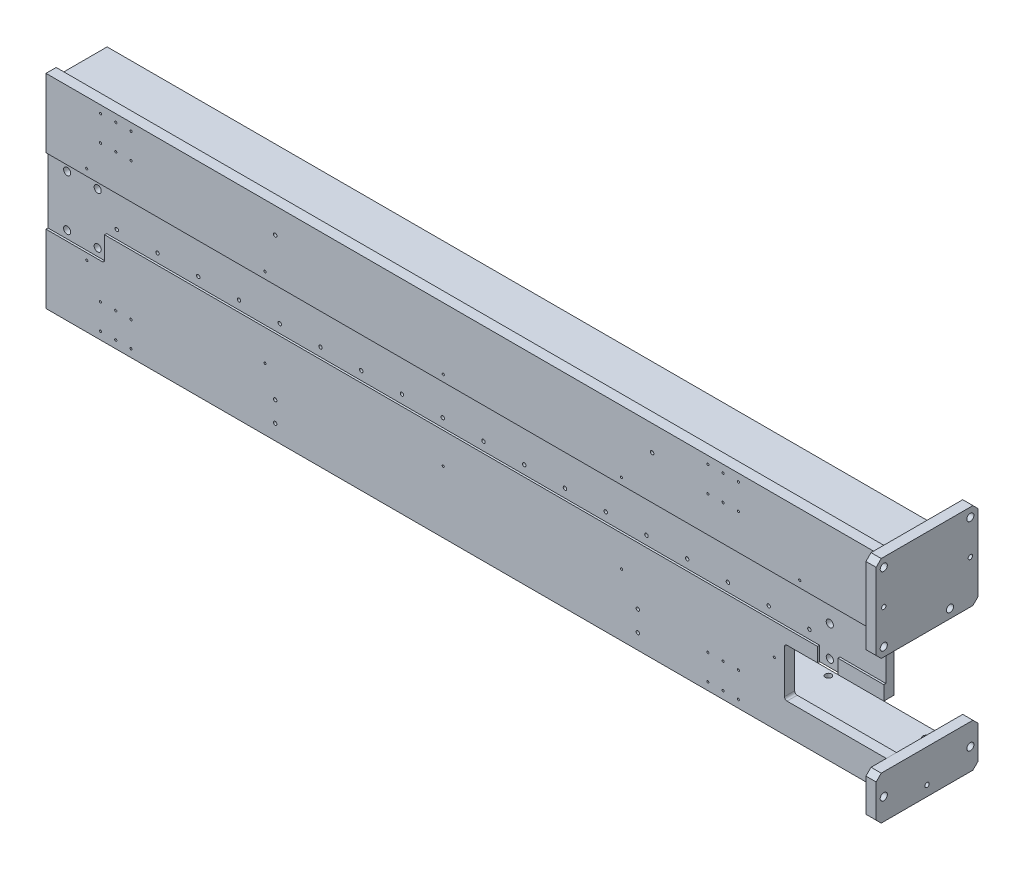
from build123d import *

# Parameters (mm, degrees)
SKETCH_1_W                   = 1650
SKETCH_1_H                   = 400
EXTRUDE_1_DEPTH              = 20
SKETCH_2_W                   = 1650
SKETCH_2_H                   = 20
EXTRUDE_2_DEPTH              = 100
EXTRUDE_2_2_DEPTH            = 100
SKETCH_3_W                   = 200
SKETCH_3_H                   = 450
EXTRUDE_3_DEPTH              = 20
SKETCH_4_W                   = 100
SKETCH_4_H                   = 330
EXTRUDE_4_DEPTH              = 20
CUT_EXTRUDE_5_DEPTH          = 4
SKETCH_17_W                  = 200
SKETCH_17_H                  = 95
CUT_EXTRUDE_6_DEPTH          = 889.960066595
SKETCH_18_W                  = 25
SKETCH_18_H                  = 195
CUT_EXTRUDE_7_DEPTH          = 898.022853667
FILLET_1_R                   = 5
CHAMFER_1_SIZE               = 10
CHAMFER_2_SIZE               = 10
HOLE_WIZARD_M5_1_AT_2_COUNT  = 2
HOLE_WIZARD_M5_1_AT_2_PITCH  = 156
HOLE_WIZARD_M5_1_AT_3_COUNT  = 2
HOLE_WIZARD_M5_1_AT_3_PITCH  = 350
HOLE_WIZARD_M5_1_AT_4_COUNT  = 2
HOLE_WIZARD_M5_1_AT_4_PITCH  = 383.191857951
HOLE_WIZARD_M5_1_AT_5_COUNT  = 2
HOLE_WIZARD_M5_1_AT_5_PITCH  = 700
HOLE_WIZARD_M5_1_AT_6_COUNT  = 2
HOLE_WIZARD_M5_1_AT_6_PITCH  = 717.172224783
HOLE_WIZARD_M5_1_AT_7_COUNT  = 2
HOLE_WIZARD_M5_1_AT_7_PITCH  = 1050
HOLE_WIZARD_M5_1_AT_8_COUNT  = 2
HOLE_WIZARD_M5_1_AT_8_PITCH  = 1061.525317644
HOLE_WIZARD_M5_1_AT_9_COUNT  = 2
HOLE_WIZARD_M5_1_AT_9_PITCH  = 1400
HOLE_WIZARD_M5_1_AT_10_COUNT = 2
HOLE_WIZARD_M5_1_AT_10_PITCH = 1358.983443608
SKETCH_22_W                  = 3.4
SKETCH_22_H                  = 60
HOLE_WIZARD_M8_1_AT_2_COUNT  = 2
HOLE_WIZARD_M8_1_AT_2_PITCH  = 80
HOLE_WIZARD_M8_1_AT_3_COUNT  = 2
HOLE_WIZARD_M8_1_AT_3_PITCH  = 160
HOLE_WIZARD_M8_1_AT_4_COUNT  = 2
HOLE_WIZARD_M8_1_AT_4_PITCH  = 240
HOLE_WIZARD_M8_1_AT_5_COUNT  = 2
HOLE_WIZARD_M8_1_AT_5_PITCH  = 320
HOLE_WIZARD_M8_1_AT_6_COUNT  = 2
HOLE_WIZARD_M8_1_AT_6_PITCH  = 400
HOLE_WIZARD_M8_1_AT_7_COUNT  = 2
HOLE_WIZARD_M8_1_AT_7_PITCH  = 560
HOLE_WIZARD_M8_1_AT_8_COUNT  = 2
HOLE_WIZARD_M8_1_AT_8_PITCH  = 640
HOLE_WIZARD_M8_1_AT_9_COUNT  = 2
HOLE_WIZARD_M8_1_AT_9_PITCH  = 720
HOLE_WIZARD_M8_1_AT_10_COUNT = 2
HOLE_WIZARD_M8_1_AT_10_PITCH = 800
HOLE_WIZARD_M8_1_AT_11_COUNT = 2
HOLE_WIZARD_M8_1_AT_11_PITCH = 880
HOLE_WIZARD_M8_1_AT_12_COUNT = 2
HOLE_WIZARD_M8_1_AT_12_PITCH = 960
HOLE_WIZARD_M8_1_AT_13_COUNT = 2
HOLE_WIZARD_M8_1_AT_13_PITCH = 1040
HOLE_WIZARD_M8_1_AT_14_COUNT = 2
HOLE_WIZARD_M8_1_AT_14_PITCH = 1120
HOLE_WIZARD_M8_1_AT_15_COUNT = 2
HOLE_WIZARD_M8_1_AT_15_PITCH = 480
HOLE_WIZARD_M8_1_AT_16_COUNT = 2
HOLE_WIZARD_M8_1_AT_16_PITCH = 1200
HOLE_WIZARD_M8_1_AT_17_COUNT = 2
HOLE_WIZARD_M8_1_AT_17_PITCH = 1280
HOLE_WIZARD_M8_1_AT_18_COUNT = 2
HOLE_WIZARD_M8_1_AT_18_PITCH = 1360
SKETCH_23_R                  = 7
CUT_EXTRUDE_8_DEPTH          = 886.578906705
SKETCH_24_R                  = 7
CUT_EXTRUDE_9_DEPTH          = 1672.144817184
SKETCH_26_R                  = 6
CUT_EXTRUDE_11_DEPTH         = 25
SKETCH_29_W                  = 10
SKETCH_29_H                  = 330
EXTRUDE_5_DEPTH              = 50
EXTRUDE_5_2_DEPTH            = 50
EXTRUDE_5_3_DEPTH            = 50
HOLE_WIZARD_M5_2_AT_2_COUNT  = 2
HOLE_WIZARD_M5_2_AT_2_PITCH  = 1234.688725955
HOLE_WIZARD_M5_2_AT_3_COUNT  = 2
HOLE_WIZARD_M5_2_AT_3_PITCH  = 276.586333719
HOLE_WIZARD_M5_2_AT_4_COUNT  = 2
HOLE_WIZARD_M5_2_AT_4_PITCH  = 271.661554144
HOLE_WIZARD_M5_2_AT_5_COUNT  = 2
HOLE_WIZARD_M5_2_AT_5_PITCH  = 321.4031736
HOLE_WIZARD_M5_2_AT_6_COUNT  = 2
HOLE_WIZARD_M5_2_AT_6_PITCH  = 325.576411922
HOLE_WIZARD_M5_2_AT_7_COUNT  = 2
HOLE_WIZARD_M5_2_AT_7_PITCH  = 1193.443023357
HOLE_WIZARD_M5_2_AT_8_COUNT  = 2
HOLE_WIZARD_M5_2_AT_8_PITCH  = 1222.684035227
HOLE_WIZARD_M5_2_AT_9_COUNT  = 2
HOLE_WIZARD_M5_2_AT_9_PITCH  = 1205.73888135
HOLE_WIZARD_M5_2_AT_10_COUNT = 2
HOLE_WIZARD_M5_2_AT_10_PITCH = 270
HOLE_WIZARD_M5_2_AT_11_COUNT = 2
HOLE_WIZARD_M5_2_AT_11_PITCH = 320
HOLE_WIZARD_M5_2_AT_12_COUNT = 2
HOLE_WIZARD_M5_2_AT_12_PITCH = 1164.240632344
HOLE_WIZARD_M5_2_AT_13_COUNT = 2
HOLE_WIZARD_M5_2_AT_13_PITCH = 1176.841641853
HOLE_WIZARD_M5_2_AT_14_COUNT = 2
HOLE_WIZARD_M5_2_AT_14_PITCH = 1133.603215415
HOLE_WIZARD_M5_2_AT_15_COUNT = 2
HOLE_WIZARD_M5_2_AT_15_PITCH = 1163.574771985
HOLE_WIZARD_M5_2_AT_16_COUNT = 2
HOLE_WIZARD_M5_2_AT_16_PITCH = 1193.547757737
HOLE_WIZARD_M5_2_AT_17_COUNT = 2
HOLE_WIZARD_M5_2_AT_17_PITCH = 1132.5
HOLE_WIZARD_M5_2_AT_18_COUNT = 2
HOLE_WIZARD_M5_2_AT_18_PITCH = 1162.5
HOLE_WIZARD_M5_2_AT_19_COUNT = 2
HOLE_WIZARD_M5_2_AT_19_PITCH = 1192.5
HOLE_WIZARD_M5_2_AT_20_COUNT = 2
HOLE_WIZARD_M5_2_AT_20_PITCH = 78.102496759
HOLE_WIZARD_M5_2_AT_21_COUNT = 2
HOLE_WIZARD_M5_2_AT_21_PITCH = 58.309518948
HOLE_WIZARD_M5_2_AT_22_COUNT = 2
HOLE_WIZARD_M5_2_AT_22_PITCH = 50
HOLE_WIZARD_M5_2_AT_23_COUNT = 2
HOLE_WIZARD_M5_2_AT_23_PITCH = 60
HOLE_WIZARD_M5_2_AT_24_COUNT = 2
HOLE_WIZARD_M5_2_AT_24_PITCH = 30
HOLE_WIZARD_M12_1_AT_2_COUNT = 2
HOLE_WIZARD_M12_1_AT_2_PITCH = 350
HOLE_WIZARD_M8_2_OUTLINE_R   = 3.4
HOLE_WIZARD_M8_2_DEPTH       = 20
SKETCH_41_W                  = 4.25
SKETCH_41_H                  = 20
HOLE_WIZARD_M10_2_AT_2_COUNT = 2
HOLE_WIZARD_M10_2_AT_2_PITCH = 355.316760089
HOLE_WIZARD_M10_2_AT_3_COUNT = 2
HOLE_WIZARD_M10_2_AT_3_PITCH = 355.316760089


# Read off the part's stored shape, not the designer's step: M10 螺纹孔1, M8 螺纹孔2
with BuildPart() as part:
    # 草图1 → 凸台-拉伸1 (new body)
    with BuildSketch(Plane.XY):
        Rectangle(SKETCH_1_W, SKETCH_1_H)
    extrude(amount=EXTRUDE_1_DEPTH)

    # 草图16 → 切除-拉伸5 (cut)
    with BuildSketch(Plane.XY.offset(20)):
        with BuildLine():
            Line((-710, -17), (690, -17))
            Line((690, -17), (690, -60))
            ThreePointArc((690, -60), (691.464466094, -63.535533906), (695, -65))
            Line((695, -65), (725, -65))
            ThreePointArc((725, -65), (728.535533906, -63.535533906), (730, -60))
            Line((730, -60), (730, -17))
            Line((730, -17), (845, -17))
            Line((845, -17), (845, 65))
            Line((845, 65), (-825, 65))
            Line((-825, 65), (-825, -65))
            Line((-825, -65), (-715, -65))
            ThreePointArc((-715, -65), (-711.464466094, -63.535533906), (-710, -60))
            Line((-710, -60), (-710, -17))
        make_face()
    extrude(amount=-CUT_EXTRUDE_5_DEPTH, mode=Mode.SUBTRACT)

    # 草图17 → 切除-拉伸6 (cut, through all)
    with BuildSketch(Plane.XY.offset(20)):
        with Locations((725, -92.5)):
            Rectangle(SKETCH_17_W, SKETCH_17_H)
    extrude(amount=-CUT_EXTRUDE_6_DEPTH, mode=Mode.SUBTRACT)


with BuildPart() as body_2:
    # 草图2 → 凸台-拉伸2 (new body)
    with BuildSketch(Plane(origin=(0, 0, 0), x_dir=(-1, 0, 0), z_dir=(0, 0, -1))):
        with Locations((0, 175)):
            Rectangle(SKETCH_2_W, SKETCH_2_H)
    extrude(amount=EXTRUDE_2_DEPTH)

    # Hole Wizard M10 _1 3 outline → Hole Wizard M10 _1 3 (revolve, cut)
    with BuildSketch(Plane(origin=(17.5, 175, 0), x_dir=(1, 0, 0), z_dir=(0, -1, 0))):
        Polygon((4.25, -75.5), (0, -72.946342369), (0, -100), (5.025, -100), (4.25, -99.225), align=None)
    revolve(axis=Axis((17.5, 175, 0), (0, 0, 1)), mode=Mode.SUBTRACT)

    # Hole Wizard M10 _1 4 outline → Hole Wizard M10 _1 4 (revolve, cut)
    with BuildSketch(Plane(origin=(-47.5, 175, 0), x_dir=(1, 0, 0), z_dir=(0, -1, 0))):
        Polygon((4.25, -75.5), (0, -72.946342369), (0, -100), (5.025, -100), (4.25, -99.225), align=None)
    revolve(axis=Axis((-47.5, 175, 0), (0, 0, 1)), mode=Mode.SUBTRACT)


with BuildPart() as body_3:
    # 草图2 → Extrude 2 2 (new body)
    with BuildSketch(Plane(origin=(0, 0, 0), x_dir=(-1, 0, 0), z_dir=(0, 0, -1))):
        with Locations((0, -175)):
            Rectangle(SKETCH_2_W, SKETCH_2_H)
    extrude(amount=EXTRUDE_2_2_DEPTH)

    # 草图26 → 切除-拉伸11 (cut)
    with BuildSketch(Plane.XZ.offset(185)):
        with Locations(Location((803.5, -79, 0), (0, 0, 270))):
            Circle(SKETCH_26_R)
        with Locations(Location((602.5, -88.77052658, 0), (0, 0, 270))):
            Circle(SKETCH_26_R)
    extrude(amount=-CUT_EXTRUDE_11_DEPTH, mode=Mode.SUBTRACT)

    # M10 螺纹孔1 outline → M10 螺纹孔1 (revolve, cut)
    with BuildSketch(Plane(origin=(-47.5, -175, 0), x_dir=(1, 0, 0), z_dir=(0, -1, 0))):
        Polygon((4.25, -75.5), (0, -72.946342369), (0, -100), (5.025, -100), (4.25, -99.225), align=None)
    revolve(axis=Axis((-47.5, -175, 0), (0, 0, 1)), mode=Mode.SUBTRACT)

    # Hole Wizard M10 _1 2 outline → Hole Wizard M10 _1 2 (revolve, cut)
    with BuildSketch(Plane(origin=(17.5, -175, 0), x_dir=(1, 0, 0), z_dir=(0, -1, 0))):
        Polygon((4.25, -75.5), (0, -72.946342369), (0, -100), (5.025, -100), (4.25, -99.225), align=None)
    revolve(axis=Axis((17.5, -175, 0), (0, 0, 1)), mode=Mode.SUBTRACT)


with BuildPart() as body_4:
    # 草图3 → 凸台-拉伸3 (new body)
    with BuildSketch(Plane(origin=(825, 0, 0), x_dir=(0, 0, -1), z_dir=(1, 0, 0))):
        with Locations((40, 0)):
            Rectangle(SKETCH_3_W, SKETCH_3_H)
    extrude(amount=EXTRUDE_3_DEPTH)


with BuildPart() as body_5:
    # 草图4 → 凸台-拉伸4 (new body)
    with BuildSketch(Plane.ZY.offset(825)):
        with Locations((-50, 0)):
            Rectangle(SKETCH_4_W, SKETCH_4_H)
    extrude(amount=-EXTRUDE_4_DEPTH)


with BuildPart() as cut_extrude_7_tool:
    # 草图18 → 切除-拉伸7 (new, through all)
    with BuildSketch(Plane(origin=(0, 0, -140), x_dir=(-1, 0, 0), z_dir=(0, 0, -1))):
        with Locations((-832.5, -42.5)):
            Rectangle(SKETCH_18_W, SKETCH_18_H)
    extrude(amount=-CUT_EXTRUDE_7_DEPTH)


with BuildPart() as part_1:
    add(part.part)

    # 切除-拉伸7: cut by cut_extrude_7_tool
    add(cut_extrude_7_tool.part, mode=Mode.SUBTRACT)

    # 圆角1
    fillet_1_edges = [part_1.edges().sort_by_distance(p)[0] for p in [
        (625, -45, 10),
        (625, -140, 10),
    ]]
    fillet(fillet_1_edges, radius=FILLET_1_R)

    # 草图20 → M5 螺纹孔1 (revolve, cut)
    with BuildSketch(Plane(origin=(-745, 78, 20), x_dir=(0, -1, 0), z_dir=(1, 0, 0))):
        Polygon((0, 0), (0, 15.2618073), (2.1, 14), (2.1, 0), align=None)
    hole_wizard_m5_1 = revolve(axis=Axis((-745, 78, 26.35), (0, 0, -1)), mode=Mode.SUBTRACT)

    # M5 螺纹孔1 at 2: M5 螺纹孔1 ×2
    with Locations(*[(0, -i * HOLE_WIZARD_M5_1_AT_2_PITCH, 0) for i in range(1, HOLE_WIZARD_M5_1_AT_2_COUNT)]):
        add(hole_wizard_m5_1, mode=Mode.SUBTRACT)

    # M5 螺纹孔1 at 3: M5 螺纹孔1 ×2
    with Locations(*[(i * HOLE_WIZARD_M5_1_AT_3_PITCH, 0, 0) for i in range(1, HOLE_WIZARD_M5_1_AT_3_COUNT)]):
        add(hole_wizard_m5_1, mode=Mode.SUBTRACT)

    # M5 螺纹孔1 at 4: M5 螺纹孔1 ×2
    with Locations(*[Vector(0.9133805761725851, -0.40710677109406634, 0) * (i * HOLE_WIZARD_M5_1_AT_4_PITCH) for i in range(1, HOLE_WIZARD_M5_1_AT_4_COUNT)]):
        add(hole_wizard_m5_1, mode=Mode.SUBTRACT)

    # M5 螺纹孔1 at 5: M5 螺纹孔1 ×2
    with Locations(*[(i * HOLE_WIZARD_M5_1_AT_5_PITCH, 0, 0) for i in range(1, HOLE_WIZARD_M5_1_AT_5_COUNT)]):
        add(hole_wizard_m5_1, mode=Mode.SUBTRACT)

    # M5 螺纹孔1 at 6: M5 螺纹孔1 ×2
    with Locations(*[Vector(0.9760556471800602, -0.21752097280012753, 0) * (i * HOLE_WIZARD_M5_1_AT_6_PITCH) for i in range(1, HOLE_WIZARD_M5_1_AT_6_COUNT)]):
        add(hole_wizard_m5_1, mode=Mode.SUBTRACT)

    # M5 螺纹孔1 at 7: M5 螺纹孔1 ×2
    with Locations(*[(i * HOLE_WIZARD_M5_1_AT_7_PITCH, 0, 0) for i in range(1, HOLE_WIZARD_M5_1_AT_7_COUNT)]):
        add(hole_wizard_m5_1, mode=Mode.SUBTRACT)

    # M5 螺纹孔1 at 8: M5 螺纹孔1 ×2
    with Locations(*[Vector(0.9891426822772774, -0.14695834136690966, 0) * (i * HOLE_WIZARD_M5_1_AT_8_PITCH) for i in range(1, HOLE_WIZARD_M5_1_AT_8_COUNT)]):
        add(hole_wizard_m5_1, mode=Mode.SUBTRACT)

    # M5 螺纹孔1 at 9: M5 螺纹孔1 ×2
    with Locations(*[(i * HOLE_WIZARD_M5_1_AT_9_PITCH, 0, 0) for i in range(1, HOLE_WIZARD_M5_1_AT_9_COUNT)]):
        add(hole_wizard_m5_1, mode=Mode.SUBTRACT)

    # M5 螺纹孔1 at 10: M5 螺纹孔1 ×2
    with Locations(*[Vector(0.9933895856862619, -0.11479168545707902, 0) * (i * HOLE_WIZARD_M5_1_AT_10_PITCH) for i in range(1, HOLE_WIZARD_M5_1_AT_10_COUNT)]):
        add(hole_wizard_m5_1, mode=Mode.SUBTRACT)

    # 草图22 → M8 螺纹孔1 (revolve, cut)
    with BuildSketch(Plane.YZ.offset(-690)):
        with Locations((1.7, 30)):
            Rectangle(SKETCH_22_W, SKETCH_22_H)
    hole_wizard_m8_1 = revolve(axis=Axis((-690, 0, -6.35), (0, 0, 1)), mode=Mode.SUBTRACT)

    # M8 螺纹孔1 at 2: M8 螺纹孔1 ×2
    with Locations(*[(i * HOLE_WIZARD_M8_1_AT_2_PITCH, 0, 0) for i in range(1, HOLE_WIZARD_M8_1_AT_2_COUNT)]):
        add(hole_wizard_m8_1, mode=Mode.SUBTRACT)

    # M8 螺纹孔1 at 3: M8 螺纹孔1 ×2
    with Locations(*[(i * HOLE_WIZARD_M8_1_AT_3_PITCH, 0, 0) for i in range(1, HOLE_WIZARD_M8_1_AT_3_COUNT)]):
        add(hole_wizard_m8_1, mode=Mode.SUBTRACT)

    # M8 螺纹孔1 at 4: M8 螺纹孔1 ×2
    with Locations(*[(i * HOLE_WIZARD_M8_1_AT_4_PITCH, 0, 0) for i in range(1, HOLE_WIZARD_M8_1_AT_4_COUNT)]):
        add(hole_wizard_m8_1, mode=Mode.SUBTRACT)

    # M8 螺纹孔1 at 5: M8 螺纹孔1 ×2
    with Locations(*[(i * HOLE_WIZARD_M8_1_AT_5_PITCH, 0, 0) for i in range(1, HOLE_WIZARD_M8_1_AT_5_COUNT)]):
        add(hole_wizard_m8_1, mode=Mode.SUBTRACT)

    # M8 螺纹孔1 at 6: M8 螺纹孔1 ×2
    with Locations(*[(i * HOLE_WIZARD_M8_1_AT_6_PITCH, 0, 0) for i in range(1, HOLE_WIZARD_M8_1_AT_6_COUNT)]):
        add(hole_wizard_m8_1, mode=Mode.SUBTRACT)

    # M8 螺纹孔1 at 7: M8 螺纹孔1 ×2
    with Locations(*[(i * HOLE_WIZARD_M8_1_AT_7_PITCH, 0, 0) for i in range(1, HOLE_WIZARD_M8_1_AT_7_COUNT)]):
        add(hole_wizard_m8_1, mode=Mode.SUBTRACT)

    # M8 螺纹孔1 at 8: M8 螺纹孔1 ×2
    with Locations(*[(i * HOLE_WIZARD_M8_1_AT_8_PITCH, 0, 0) for i in range(1, HOLE_WIZARD_M8_1_AT_8_COUNT)]):
        add(hole_wizard_m8_1, mode=Mode.SUBTRACT)

    # M8 螺纹孔1 at 9: M8 螺纹孔1 ×2
    with Locations(*[(i * HOLE_WIZARD_M8_1_AT_9_PITCH, 0, 0) for i in range(1, HOLE_WIZARD_M8_1_AT_9_COUNT)]):
        add(hole_wizard_m8_1, mode=Mode.SUBTRACT)

    # M8 螺纹孔1 at 10: M8 螺纹孔1 ×2
    with Locations(*[(i * HOLE_WIZARD_M8_1_AT_10_PITCH, 0, 0) for i in range(1, HOLE_WIZARD_M8_1_AT_10_COUNT)]):
        add(hole_wizard_m8_1, mode=Mode.SUBTRACT)

    # M8 螺纹孔1 at 11: M8 螺纹孔1 ×2
    with Locations(*[(i * HOLE_WIZARD_M8_1_AT_11_PITCH, 0, 0) for i in range(1, HOLE_WIZARD_M8_1_AT_11_COUNT)]):
        add(hole_wizard_m8_1, mode=Mode.SUBTRACT)

    # M8 螺纹孔1 at 12: M8 螺纹孔1 ×2
    with Locations(*[(i * HOLE_WIZARD_M8_1_AT_12_PITCH, 0, 0) for i in range(1, HOLE_WIZARD_M8_1_AT_12_COUNT)]):
        add(hole_wizard_m8_1, mode=Mode.SUBTRACT)

    # M8 螺纹孔1 at 13: M8 螺纹孔1 ×2
    with Locations(*[(i * HOLE_WIZARD_M8_1_AT_13_PITCH, 0, 0) for i in range(1, HOLE_WIZARD_M8_1_AT_13_COUNT)]):
        add(hole_wizard_m8_1, mode=Mode.SUBTRACT)

    # M8 螺纹孔1 at 14: M8 螺纹孔1 ×2
    with Locations(*[(i * HOLE_WIZARD_M8_1_AT_14_PITCH, 0, 0) for i in range(1, HOLE_WIZARD_M8_1_AT_14_COUNT)]):
        add(hole_wizard_m8_1, mode=Mode.SUBTRACT)

    # M8 螺纹孔1 at 15: M8 螺纹孔1 ×2
    with Locations(*[(i * HOLE_WIZARD_M8_1_AT_15_PITCH, 0, 0) for i in range(1, HOLE_WIZARD_M8_1_AT_15_COUNT)]):
        add(hole_wizard_m8_1, mode=Mode.SUBTRACT)

    # M8 螺纹孔1 at 16: M8 螺纹孔1 ×2
    with Locations(*[(i * HOLE_WIZARD_M8_1_AT_16_PITCH, 0, 0) for i in range(1, HOLE_WIZARD_M8_1_AT_16_COUNT)]):
        add(hole_wizard_m8_1, mode=Mode.SUBTRACT)

    # M8 螺纹孔1 at 17: M8 螺纹孔1 ×2
    with Locations(*[(i * HOLE_WIZARD_M8_1_AT_17_PITCH, 0, 0) for i in range(1, HOLE_WIZARD_M8_1_AT_17_COUNT)]):
        add(hole_wizard_m8_1, mode=Mode.SUBTRACT)

    # M8 螺纹孔1 at 18: M8 螺纹孔1 ×2
    with Locations(*[(i * HOLE_WIZARD_M8_1_AT_18_PITCH, 0, 0) for i in range(1, HOLE_WIZARD_M8_1_AT_18_COUNT)]):
        add(hole_wizard_m8_1, mode=Mode.SUBTRACT)

    # 草图23 → 切除-拉伸8 (cut, through all)
    with BuildSketch(Plane(origin=(0, 0, 0), x_dir=(-1, 0, 0), z_dir=(0, 0, -1))):
        with Locations((787.5, 50)):
            Circle(SKETCH_23_R)
        with Locations((787.5, -50)):
            Circle(SKETCH_23_R)
        with Locations((727.5, -50)):
            Circle(SKETCH_23_R)
        with Locations((727.5, 50)):
            Circle(SKETCH_23_R)
        with Locations((-710, 30)):
            Circle(SKETCH_23_R)
        with Locations((-710, -30)):
            Circle(SKETCH_23_R)
    extrude(amount=-CUT_EXTRUDE_8_DEPTH, mode=Mode.SUBTRACT)

    # 草图31 → M5 螺纹孔2 (revolve, cut)
    with BuildSketch(Plane(origin=(-658, 135, 20), x_dir=(0, -1, 0), z_dir=(1, 0, 0))):
        Polygon((0, 0), (0, 15.2618073), (2.1, 14), (2.1, 0), align=None)
    hole_wizard_m5_2 = revolve(axis=Axis((-658, 135, 26.35), (0, 0, -1)), mode=Mode.SUBTRACT)

    # M5 螺纹孔2 at 2: M5 螺纹孔2 ×2
    with Locations(*[Vector(0.9658304760803423, -0.25917463509074196, 0) * (i * HOLE_WIZARD_M5_2_AT_2_PITCH) for i in range(1, HOLE_WIZARD_M5_2_AT_2_COUNT)]):
        add(hole_wizard_m5_2, mode=Mode.SUBTRACT)

    # M5 螺纹孔2 at 3: M5 螺纹孔2 ×2
    with Locations(*[Vector(-0.21693045781865639, -0.9761870601839527, 0) * (i * HOLE_WIZARD_M5_2_AT_3_PITCH) for i in range(1, HOLE_WIZARD_M5_2_AT_3_COUNT)]):
        add(hole_wizard_m5_2, mode=Mode.SUBTRACT)

    # M5 螺纹孔2 at 4: M5 螺纹孔2 ×2
    with Locations(*[Vector(-0.11043152607484688, -0.993883734673619, 0) * (i * HOLE_WIZARD_M5_2_AT_4_PITCH) for i in range(1, HOLE_WIZARD_M5_2_AT_4_COUNT)]):
        add(hole_wizard_m5_2, mode=Mode.SUBTRACT)

    # M5 螺纹孔2 at 5: M5 螺纹孔2 ×2
    with Locations(*[Vector(-0.09334070869305855, -0.9956342260592882, 0) * (i * HOLE_WIZARD_M5_2_AT_5_PITCH) for i in range(1, HOLE_WIZARD_M5_2_AT_5_COUNT)]):
        add(hole_wizard_m5_2, mode=Mode.SUBTRACT)

    # M5 螺纹孔2 at 6: M5 螺纹孔2 ×2
    with Locations(*[Vector(-0.18428853505018558, -0.9828721869343219, 0) * (i * HOLE_WIZARD_M5_2_AT_6_PITCH) for i in range(1, HOLE_WIZARD_M5_2_AT_6_COUNT)]):
        add(hole_wizard_m5_2, mode=Mode.SUBTRACT)

    # M5 螺纹孔2 at 7: M5 螺纹孔2 ×2
    with Locations(*[Vector(0.9740724753912703, -0.22623618783281138, 0) * (i * HOLE_WIZARD_M5_2_AT_7_PITCH) for i in range(1, HOLE_WIZARD_M5_2_AT_7_COUNT)]):
        add(hole_wizard_m5_2, mode=Mode.SUBTRACT)

    # M5 螺纹孔2 at 8: M5 螺纹孔2 ×2
    with Locations(*[Vector(0.9753132989735953, -0.22082565259779532, 0) * (i * HOLE_WIZARD_M5_2_AT_8_PITCH) for i in range(1, HOLE_WIZARD_M5_2_AT_8_COUNT)]):
        add(hole_wizard_m5_2, mode=Mode.SUBTRACT)

    # M5 螺纹孔2 at 9: M5 螺纹孔2 ×2
    with Locations(*[Vector(0.964139100082824, -0.26539742970021846, 0) * (i * HOLE_WIZARD_M5_2_AT_9_PITCH) for i in range(1, HOLE_WIZARD_M5_2_AT_9_COUNT)]):
        add(hole_wizard_m5_2, mode=Mode.SUBTRACT)

    # M5 螺纹孔2 at 10: M5 螺纹孔2 ×2
    with Locations(*[(0, -i * HOLE_WIZARD_M5_2_AT_10_PITCH, 0) for i in range(1, HOLE_WIZARD_M5_2_AT_10_COUNT)]):
        add(hole_wizard_m5_2, mode=Mode.SUBTRACT)

    # M5 螺纹孔2 at 11: M5 螺纹孔2 ×2
    with Locations(*[(0, -i * HOLE_WIZARD_M5_2_AT_11_PITCH, 0) for i in range(1, HOLE_WIZARD_M5_2_AT_11_COUNT)]):
        add(hole_wizard_m5_2, mode=Mode.SUBTRACT)

    # M5 螺纹孔2 at 12: M5 螺纹孔2 ×2
    with Locations(*[Vector(0.972737051549404, -0.23191082023694426, 0) * (i * HOLE_WIZARD_M5_2_AT_12_PITCH) for i in range(1, HOLE_WIZARD_M5_2_AT_12_COUNT)]):
        add(hole_wizard_m5_2, mode=Mode.SUBTRACT)

    # M5 螺纹孔2 at 13: M5 螺纹孔2 ×2
    with Locations(*[Vector(0.9623214880606346, -0.27191423945201176, 0) * (i * HOLE_WIZARD_M5_2_AT_13_PITCH) for i in range(1, HOLE_WIZARD_M5_2_AT_13_COUNT)]):
        add(hole_wizard_m5_2, mode=Mode.SUBTRACT)

    # M5 螺纹孔2 at 14: M5 螺纹孔2 ×2
    with Locations(*[Vector(0.9990268063813345, 0.044107143769595354, 0) * (i * HOLE_WIZARD_M5_2_AT_14_PITCH) for i in range(1, HOLE_WIZARD_M5_2_AT_14_COUNT)]):
        add(hole_wizard_m5_2, mode=Mode.SUBTRACT)

    # M5 螺纹孔2 at 15: M5 螺纹孔2 ×2
    with Locations(*[Vector(0.9990763189346309, 0.042971024470306714, 0) * (i * HOLE_WIZARD_M5_2_AT_15_PITCH) for i in range(1, HOLE_WIZARD_M5_2_AT_15_COUNT)]):
        add(hole_wizard_m5_2, mode=Mode.SUBTRACT)

    # M5 螺纹孔2 at 16: M5 螺纹孔2 ×2
    with Locations(*[Vector(0.9991221484598182, 0.04189191398154374, 0) * (i * HOLE_WIZARD_M5_2_AT_16_PITCH) for i in range(1, HOLE_WIZARD_M5_2_AT_16_COUNT)]):
        add(hole_wizard_m5_2, mode=Mode.SUBTRACT)

    # M5 螺纹孔2 at 17: M5 螺纹孔2 ×2
    with Locations(*[(i * HOLE_WIZARD_M5_2_AT_17_PITCH, 0, 0) for i in range(1, HOLE_WIZARD_M5_2_AT_17_COUNT)]):
        add(hole_wizard_m5_2, mode=Mode.SUBTRACT)

    # M5 螺纹孔2 at 18: M5 螺纹孔2 ×2
    with Locations(*[(i * HOLE_WIZARD_M5_2_AT_18_PITCH, 0, 0) for i in range(1, HOLE_WIZARD_M5_2_AT_18_COUNT)]):
        add(hole_wizard_m5_2, mode=Mode.SUBTRACT)

    # M5 螺纹孔2 at 19: M5 螺纹孔2 ×2
    with Locations(*[(i * HOLE_WIZARD_M5_2_AT_19_PITCH, 0, 0) for i in range(1, HOLE_WIZARD_M5_2_AT_19_COUNT)]):
        add(hole_wizard_m5_2, mode=Mode.SUBTRACT)

    # M5 螺纹孔2 at 20: M5 螺纹孔2 ×2
    with Locations(*[Vector(-0.7682212795973765, 0.6401843996644792, 0) * (i * HOLE_WIZARD_M5_2_AT_20_PITCH) for i in range(1, HOLE_WIZARD_M5_2_AT_20_COUNT)]):
        add(hole_wizard_m5_2, mode=Mode.SUBTRACT)

    # M5 螺纹孔2 at 21: M5 螺纹孔2 ×2
    with Locations(*[Vector(-0.514495755427528, 0.8574929257125433, 0) * (i * HOLE_WIZARD_M5_2_AT_21_PITCH) for i in range(1, HOLE_WIZARD_M5_2_AT_21_COUNT)]):
        add(hole_wizard_m5_2, mode=Mode.SUBTRACT)

    # M5 螺纹孔2 at 22: M5 螺纹孔2 ×2
    with Locations(*[(0, i * HOLE_WIZARD_M5_2_AT_22_PITCH, 0) for i in range(1, HOLE_WIZARD_M5_2_AT_22_COUNT)]):
        add(hole_wizard_m5_2, mode=Mode.SUBTRACT)

    # M5 螺纹孔2 at 23: M5 螺纹孔2 ×2
    with Locations(*[(-i * HOLE_WIZARD_M5_2_AT_23_PITCH, 0, 0) for i in range(1, HOLE_WIZARD_M5_2_AT_23_COUNT)]):
        add(hole_wizard_m5_2, mode=Mode.SUBTRACT)

    # M5 螺纹孔2 at 24: M5 螺纹孔2 ×2
    with Locations(*[(-i * HOLE_WIZARD_M5_2_AT_24_PITCH, 0, 0) for i in range(1, HOLE_WIZARD_M5_2_AT_24_COUNT)]):
        add(hole_wizard_m5_2, mode=Mode.SUBTRACT)

    # 草图33 → M12 螺纹孔1 (revolve, cut)
    with BuildSketch(Plane(origin=(-825, -175, 10), x_dir=(0, 0, 1), z_dir=(0, 1, 0))):
        Polygon((0, 0), (0, 32.314389157), (5.1, 29.25), (5.1, 0), align=None)
    hole_wizard_m12_1 = revolve(axis=Axis((-831.35, -175, 10), (1, 0, 0)), mode=Mode.SUBTRACT)

    # M12 螺纹孔1 at 2: M12 螺纹孔1 ×2
    with Locations(*[(0, i * HOLE_WIZARD_M12_1_AT_2_PITCH, 0) for i in range(1, HOLE_WIZARD_M12_1_AT_2_COUNT)]):
        add(hole_wizard_m12_1, mode=Mode.SUBTRACT)

    # M8 螺纹孔2 outline → M8 螺纹孔2 (cut)
    with BuildSketch(Plane.XY):
        with Locations((337, -170)):
            Circle(HOLE_WIZARD_M8_2_OUTLINE_R)
        with Locations((-375, -170)):
            Circle(HOLE_WIZARD_M8_2_OUTLINE_R)
        with Locations((337, -130)):
            Circle(HOLE_WIZARD_M8_2_OUTLINE_R)
        with Locations((-375, -130)):
            Circle(HOLE_WIZARD_M8_2_OUTLINE_R)
        with Locations((365.2, 150)):
            Circle(HOLE_WIZARD_M8_2_OUTLINE_R)
        with Locations((-375, 150)):
            Circle(HOLE_WIZARD_M8_2_OUTLINE_R)
    extrude(amount=HOLE_WIZARD_M8_2_DEPTH, mode=Mode.SUBTRACT)


with BuildPart() as body_4_1:
    add(body_4.part)

    # 切除-拉伸7: cut by cut_extrude_7_tool
    add(cut_extrude_7_tool.part, mode=Mode.SUBTRACT)

    # 倒角1
    chamfer_1_edges = [body_4_1.edges().sort_by_distance(p)[0] for p in [
        (835, -140, 60),
        (835, -140, -140),
        (835, -225, -140),
        (835, -225, 60),
    ]]
    chamfer(chamfer_1_edges, length=CHAMFER_1_SIZE)

    # 倒角2
    chamfer_2_edges = [body_4_1.edges().sort_by_distance(p)[0] for p in [
        (835, 55, 60),
        (835, 225, 60),
        (835, 225, -140),
        (835, 55, -140),
    ]]
    chamfer(chamfer_2_edges, length=CHAMFER_2_SIZE)

    # 草图24 → 切除-拉伸9 (cut, through all)
    with BuildSketch(Plane.ZY.offset(-825)):
        with Locations((45, 207.5)):
            Circle(SKETCH_24_R)
        with Locations((-125, 207.5)):
            Circle(SKETCH_24_R)
        with Locations((45, 72.5)):
            Circle(SKETCH_24_R)
        with Locations((-125, -182.5)):
            Circle(SKETCH_24_R)
        with Locations((45, -182.5)):
            Circle(SKETCH_24_R)
        with Locations((-85, 72.5)):
            Circle(SKETCH_24_R)
    extrude(amount=-CUT_EXTRUDE_9_DEPTH, mode=Mode.SUBTRACT)

    # 草图41 → M10 螺纹孔2 (revolve, cut)
    with BuildSketch(Plane(origin=(825, -205, -40), x_dir=(0, 0, 1), z_dir=(0, 1, 0))):
        with Locations((2.125, 10)):
            Rectangle(SKETCH_41_W, SKETCH_41_H)
    hole_wizard_m10_2 = revolve(axis=Axis((818.65, -205, -40), (1, 0, 0)), mode=Mode.SUBTRACT)

    # M10 螺纹孔2 at 2: M10 螺纹孔2 ×2
    with Locations(*[Vector(0, 0.9709646117278028, -0.23922316520829925) * (i * HOLE_WIZARD_M10_2_AT_2_PITCH) for i in range(1, HOLE_WIZARD_M10_2_AT_2_COUNT)]):
        add(hole_wizard_m10_2, mode=Mode.SUBTRACT)

    # M10 螺纹孔2 at 3: M10 螺纹孔2 ×2
    with Locations(*[Vector(0, 0.9709646117278029, 0.239223165208299) * (i * HOLE_WIZARD_M10_2_AT_3_PITCH) for i in range(1, HOLE_WIZARD_M10_2_AT_3_COUNT)]):
        add(hole_wizard_m10_2, mode=Mode.SUBTRACT)


with BuildPart() as body_6:
    # 草图29 → 凸台-拉伸5 (new body)
    with BuildSketch(Plane(origin=(0, 0, 0), x_dir=(-1, 0, 0), z_dir=(0, 0, -1))):
        with Locations((395, 0)):
            Rectangle(SKETCH_29_W, SKETCH_29_H)
    extrude(amount=EXTRUDE_5_DEPTH)


with BuildPart() as body_7:
    # 草图29 → Extrude 5 2 (new body)
    with BuildSketch(Plane(origin=(0, 0, 0), x_dir=(-1, 0, 0), z_dir=(0, 0, -1))):
        with Locations((45, 0)):
            Rectangle(SKETCH_29_W, SKETCH_29_H)
    extrude(amount=EXTRUDE_5_2_DEPTH)


with BuildPart() as body_8:
    # 草图29 → Extrude 5 3 (new body)
    with BuildSketch(Plane(origin=(0, 0, 0), x_dir=(-1, 0, 0), z_dir=(0, 0, -1))):
        with Locations((-305, 0)):
            Rectangle(SKETCH_29_W, SKETCH_29_H)
    extrude(amount=EXTRUDE_5_3_DEPTH)


solid = Compound([body_2.part, body_3.part, body_5.part, part_1.part, body_4_1.part, body_6.part, body_7.part, body_8.part])
